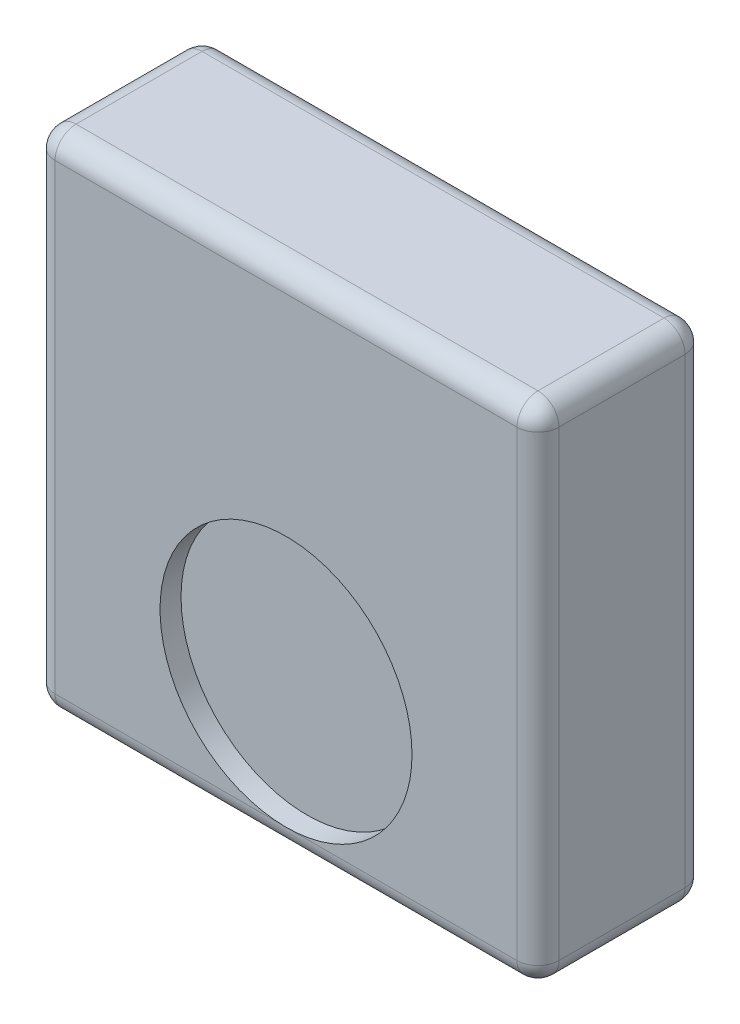
from build123d import *

# Parameters (mm, degrees)
SKETCH1_W           = 152.4
SKETCH1_H           = 152.4
BOSS_EXTRUDE1_DEPTH = 25.4
SKETCH2_R           = 38.1
CUT_EXTRUDE1_DEPTH  = 6.35
FILLET1_R           = 6.35


with BuildPart() as part:
    # Sketch1 → Boss-Extrude1 (new, symmetric)
    with BuildSketch(Plane.XY):
        Rectangle(SKETCH1_W, SKETCH1_H)
    extrude(amount=BOSS_EXTRUDE1_DEPTH, both=True)

    # Sketch2 → Cut-Extrude1 (cut)
    with BuildSketch(Plane.XY.offset(25.4)):
        with Locations((0, -31.75)):
            Circle(SKETCH2_R)
    extrude(amount=-CUT_EXTRUDE1_DEPTH, mode=Mode.SUBTRACT)

    # Fillet1
    fillet1_edges = [part.edges().sort_by_distance(p)[0] for p in [
        (-76.2, 0, 25.4),
        (0, -76.2, 25.4),
        (76.2, 0, 25.4),
        (0, -76.2, -25.4),
        (-76.2, 0, -25.4),
        (0, 76.2, -25.4),
        (76.2, 0, -25.4),
        (76.2, -76.2, 0),
        (-76.2, -76.2, 0),
        (-76.2, 76.2, 0),
        (76.2, 76.2, 0),
        (0, 76.2, 25.4),
    ]]
    fillet(fillet1_edges, radius=FILLET1_R - 0.0001)  # a hair under: the kernel refuses the full size


solid = part.part
